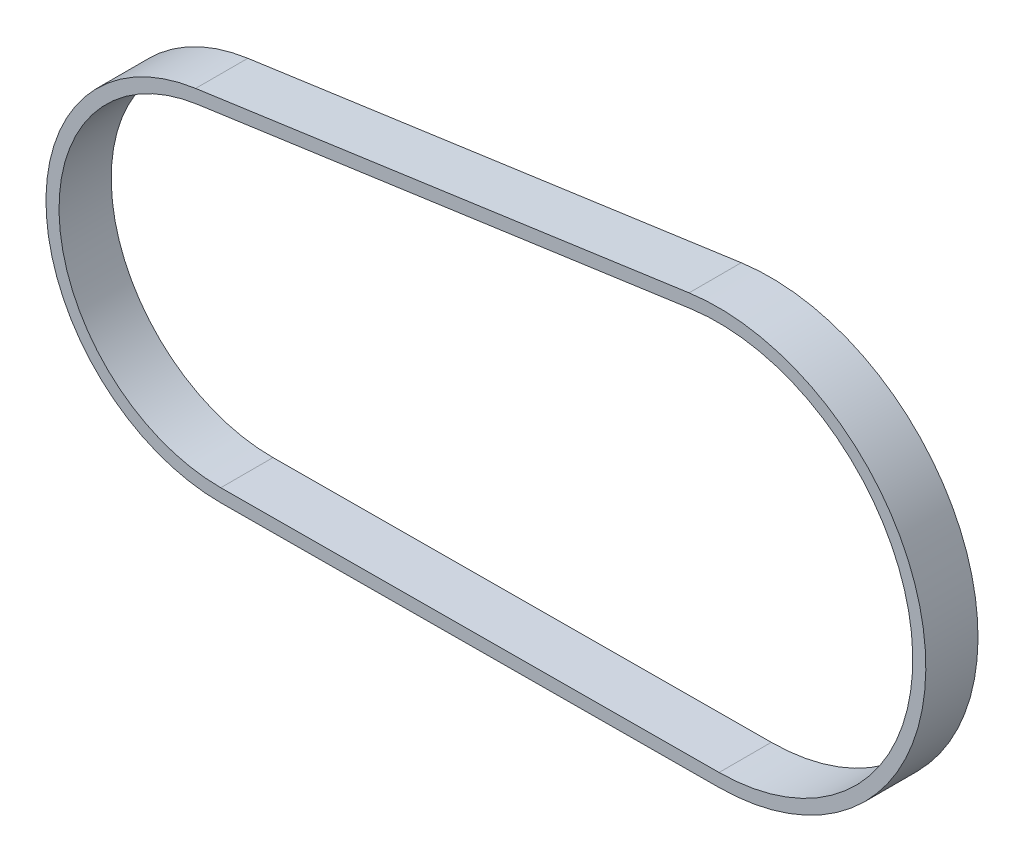
from build123d import *

# Parameters (mm, degrees)
EXTRUDE_THIN1_DEPTH = 6


with BuildPart() as part:
    # Sketch2 → Extrude-Thin1 (new body)
    with BuildSketch(Plane.XY):
        with BuildLine():
            Line((-2.796176126, 19.803570362), (53.921991485, 27.811923568))
            ThreePointArc((53.921991485, 27.811923568), (81.072990553, 5.904787484), (57.382809791, -19.705263224))
            Line((57.382809791, -19.705263224), (0.102817261, -19.999735714))
            ThreePointArc((0.102817261, -19.999735714), (-19.947163686, -1.45281137), (-2.796176126, 19.803570362))
        make_face()
        with BuildLine():
            Line((-2.586462917, 18.318302585), (54.131704694, 26.326655791))
            ThreePointArc((54.131704694, 26.326655791), (79.576953276, 5.795826631), (57.375098496, -18.205283046))
            Line((57.375098496, -18.205283046), (0.095105967, -18.499755535))
            ThreePointArc((0.095105967, -18.499755535), (-18.45112641, -1.343850517), (-2.586462917, 18.318302585))
        make_face(mode=Mode.SUBTRACT)
    extrude(amount=-EXTRUDE_THIN1_DEPTH)


solid = part.part
